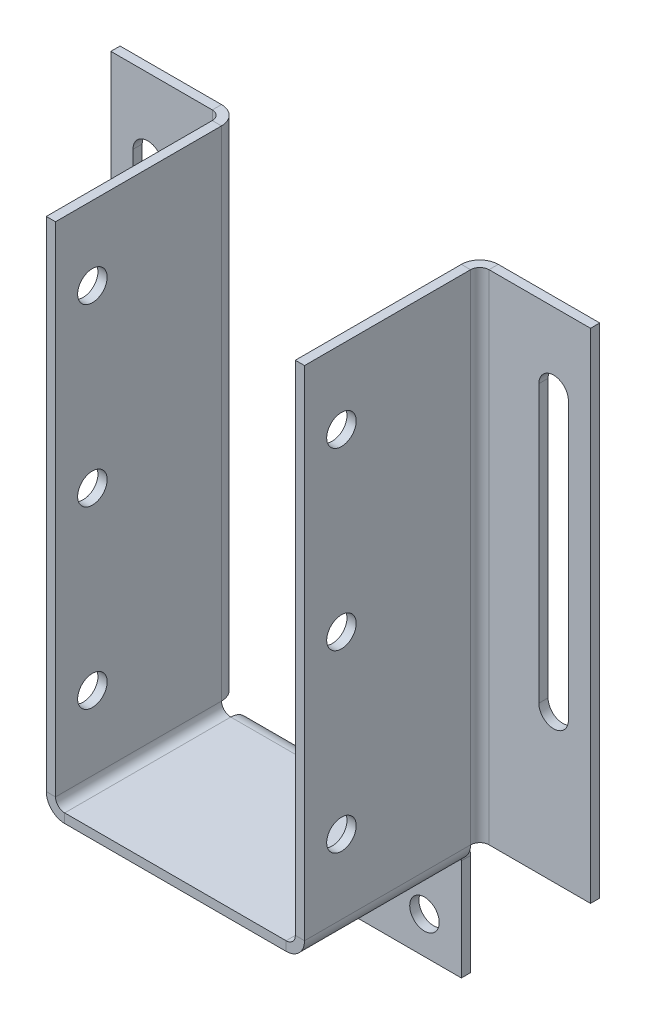
from build123d import *

# Parameters (mm, degrees)
BASE_FLANGE_DEPTH         = 31.75
MITER_FLANGE2_DEPTH       = 88.9
MITER_FLANGE2_2_DEPTH     = 3.175
MITER_START               = 3.175
MITER_FLANGE2_3_DEPTH     = 85.725
MITER_START_2             = -19.05
MITER_FLANGE2_4_OUTLINE_W = 19.05
MITER_FLANGE2_4_OUTLINE_H = 1.5875
MITER_FLANGE2_4_DEPTH     = 17.4625
MITER_FLANGE2_5_DEPTH     = 19.05
MITER_FLANGE2_6_DEPTH     = 19.05
CUT_EXTRUDE5_DEPTH        = 1.5875
CUT_EXTRUDE2_REACH        = 105.029
SKETCH5_R                 = 2.54
CUT_EXTRUDE4_REACH        = 107.049
SKETCH7_R                 = 2.54


with BuildPart() as part:
    # Base-Flange: sheet metal written as solids
    # Sketch1 → Base-Flange (new body)
    with BuildSketch(Plane.XY):
        with BuildLine():
            Line((0, 0), (19.05, 0))
            ThreePointArc((19.05, 0), (21.29506403, 0.92993597), (22.225, 3.175))
            Line((22.225, 3.175), (22.225, 88.9))
            Line((22.225, 88.9), (20.6375, 88.9))
            Line((20.6375, 88.9), (20.6375, 3.175))
            ThreePointArc((20.6375, 3.175), (20.172532015, 2.052467985), (19.05, 1.5875))
            Line((19.05, 1.5875), (0, 1.5875))
            Line((0, 1.5875), (0, 0))
        make_face()
    extrude(amount=BASE_FLANGE_DEPTH)

    # Miter Flange2: read off the stored shape, not the designer's step
    # Miter Flange2 outline → Miter Flange2 (cut)
    with BuildSketch(Plane(origin=(0, 0, 0), x_dir=(1, 0, 0), z_dir=(0, 1, 0))):
        with BuildLine():
            Line((22.225, 0), (19.05, 0))
            Line((19.05, 0), (19.05, -3.175))
            Line((19.05, -3.175), (20.6375, -3.175))
            ThreePointArc((20.6375, -3.175), (21.062869343, -1.5875), (22.225, -0.425369343))
            Line((22.225, -0.425369343), (22.225, 0))
        make_face()
    extrude(amount=MITER_FLANGE2_DEPTH, mode=Mode.SUBTRACT)

    # Miter Flange2 2 outline → Miter Flange2 2 (cut)
    with BuildSketch(Plane(origin=(0, 0, 0), x_dir=(1, 0, 0), z_dir=(0, 1, 0))):
        with BuildLine():
            Line((20.6375, -3.175), (22.225, -3.175))
            Line((22.225, -3.175), (22.225, -0.425369343))
            ThreePointArc((22.225, -0.425369343), (21.062869343, -1.5875), (20.6375, -3.175))
        make_face()
    extrude(amount=MITER_FLANGE2_2_DEPTH, mode=Mode.SUBTRACT)

    # Miter Flange2 3 outline → Miter Flange2 3 (add)
    with BuildSketch(Plane(origin=(0, 0, 0), x_dir=(1, 0, 0), z_dir=(0, 1, 0)).offset(MITER_START)):
        with BuildLine():
            Line((22.225, -0.425369343), (22.225, -3.175))
            ThreePointArc((22.225, -3.175), (22.689967985, -2.052467985), (23.8125, -1.5875))
            Line((23.8125, -1.5875), (41.275, -1.5875))
            Line((41.275, -1.5875), (41.275, 0))
            Line((41.275, 0), (23.8125, 0))
            ThreePointArc((23.8125, 0), (22.990749532, -0.108185502), (22.225, -0.425369343))
        make_face()
    extrude(amount=MITER_FLANGE2_3_DEPTH)

    # Miter Flange2 5 outline → Miter Flange2 5 (cut)
    with BuildSketch(Plane.YZ):
        with BuildLine():
            ThreePointArc((1.5875, 3.175), (1.162130657, 1.5875), (0, 0.425369343))
            Line((0, 0.425369343), (0, 0))
            Line((0, 0), (1.5875, 0))
            Line((1.5875, 0), (1.5875, 3.175))
        make_face()
    extrude(amount=MITER_FLANGE2_5_DEPTH, mode=Mode.SUBTRACT)



with BuildPart() as body_2:
    # Miter Flange2 4 outline → Miter Flange2 4 (new body)
    with BuildSketch(Plane(origin=(0, 0, 0), x_dir=(1, 0, 0), z_dir=(0, 1, 0)).offset(MITER_START_2)):
        with Locations((9.525, -0.79375)):
            Rectangle(MITER_FLANGE2_4_OUTLINE_W, MITER_FLANGE2_4_OUTLINE_H)
    extrude(amount=MITER_FLANGE2_4_DEPTH)


with BuildPart() as part_1:
    add(part.part)

    add(body_2.part)  # Miter Flange2 6 merges body 2
    # Miter Flange2 6 outline → Miter Flange2 6 (add)
    with BuildSketch(Plane.YZ):
        with BuildLine():
            Line((0, 0.425369343), (0, 3.175))
            ThreePointArc((0, 3.175), (-0.464967985, 2.052467985), (-1.5875, 1.5875))
            Line((-1.5875, 1.5875), (-1.5875, 0))
            ThreePointArc((-1.5875, 0), (-0.765749532, 0.108185502), (0, 0.425369343))
        make_face()
    extrude(amount=MITER_FLANGE2_6_DEPTH)

    # Sketch8 → Cut-Extrude5 (cut)
    with BuildSketch(Plane.XY.offset(1.5875)):
        with BuildLine():
            Line((32.385, 76.2), (32.385, 28.575))
            ThreePointArc((32.385, 28.575), (34.925, 26.035), (37.465, 28.575))
            Line((37.465, 28.575), (37.465, 76.2))
            ThreePointArc((37.465, 76.2), (34.925, 78.74), (32.385, 76.2))
        make_face()
    extrude(amount=-CUT_EXTRUDE5_DEPTH, mode=Mode.SUBTRACT)

    # Sketch5 → Cut-Extrude2 (cut, up to next)
    with BuildSketch(Plane(origin=(0, 0, 0), x_dir=(-1, 0, 0), z_dir=(0, 0, -1)), mode=Mode.PRIVATE) as cut_extrude2_sk1:
        with Locations((-12.7, -12.7)):
            Circle(SKETCH5_R)
    cut_extrude2_tool1 = extrude(cut_extrude2_sk1.sketch, amount=-CUT_EXTRUDE2_REACH, mode=Mode.PRIVATE) & part_1.part
    add(cut_extrude2_tool1.solids().sort_by_distance((12.7, -12.7, 0))[0], mode=Mode.SUBTRACT)

    # Sketch7 → Cut-Extrude4 (cut, up to next)
    with BuildSketch(Plane(origin=(22.225, -0.213353633, 50.991788494), x_dir=(0, 0, -1), z_dir=(1, 0, 0)), mode=Mode.PRIVATE) as cut_extrude4_sk1:
        with Locations(Location((25.591788494, 76.413353633, 0), (0, 0, 90))):
            Circle(SKETCH7_R)
    cut_extrude4_tool1 = extrude(cut_extrude4_sk1.sketch, amount=-CUT_EXTRUDE4_REACH, mode=Mode.PRIVATE) & part_1.part
    # Sketch7 → Cut-Extrude4 (cut, up to next)
    with BuildSketch(Plane(origin=(22.225, -0.213353633, 50.991788494), x_dir=(0, 0, -1), z_dir=(1, 0, 0)), mode=Mode.PRIVATE) as cut_extrude4_sk2:
        with Locations(Location((25.591788494, 46.250853633, 0), (0, 0, 90))):
            Circle(SKETCH7_R)
    cut_extrude4_tool2 = extrude(cut_extrude4_sk2.sketch, amount=-CUT_EXTRUDE4_REACH, mode=Mode.PRIVATE) & part_1.part
    # Sketch7 → Cut-Extrude4 (cut, up to next)
    with BuildSketch(Plane(origin=(22.225, -0.213353633, 50.991788494), x_dir=(0, 0, -1), z_dir=(1, 0, 0)), mode=Mode.PRIVATE) as cut_extrude4_sk3:
        with Locations(Location((25.591788494, 16.088353633, 0), (0, 0, 90))):
            Circle(SKETCH7_R)
    cut_extrude4_tool3 = extrude(cut_extrude4_sk3.sketch, amount=-CUT_EXTRUDE4_REACH, mode=Mode.PRIVATE) & part_1.part
    add(cut_extrude4_tool1.solids().sort_by_distance((22.225, 76.2, 25.4))[0], mode=Mode.SUBTRACT)
    add(cut_extrude4_tool2.solids().sort_by_distance((22.225, 46.0375, 25.4))[0], mode=Mode.SUBTRACT)
    add(cut_extrude4_tool3.solids().sort_by_distance((22.225, 15.875, 25.4))[0], mode=Mode.SUBTRACT)

    # SHM-Mirror1: part across plane


with BuildPart() as part_2:
    add(part_1.part)
    add(part_1.part.mirror(Plane(origin=(0, 0, 31.75), x_dir=(0, 0, 1), z_dir=(-1, 0, 0))))


solid = part_2.part
